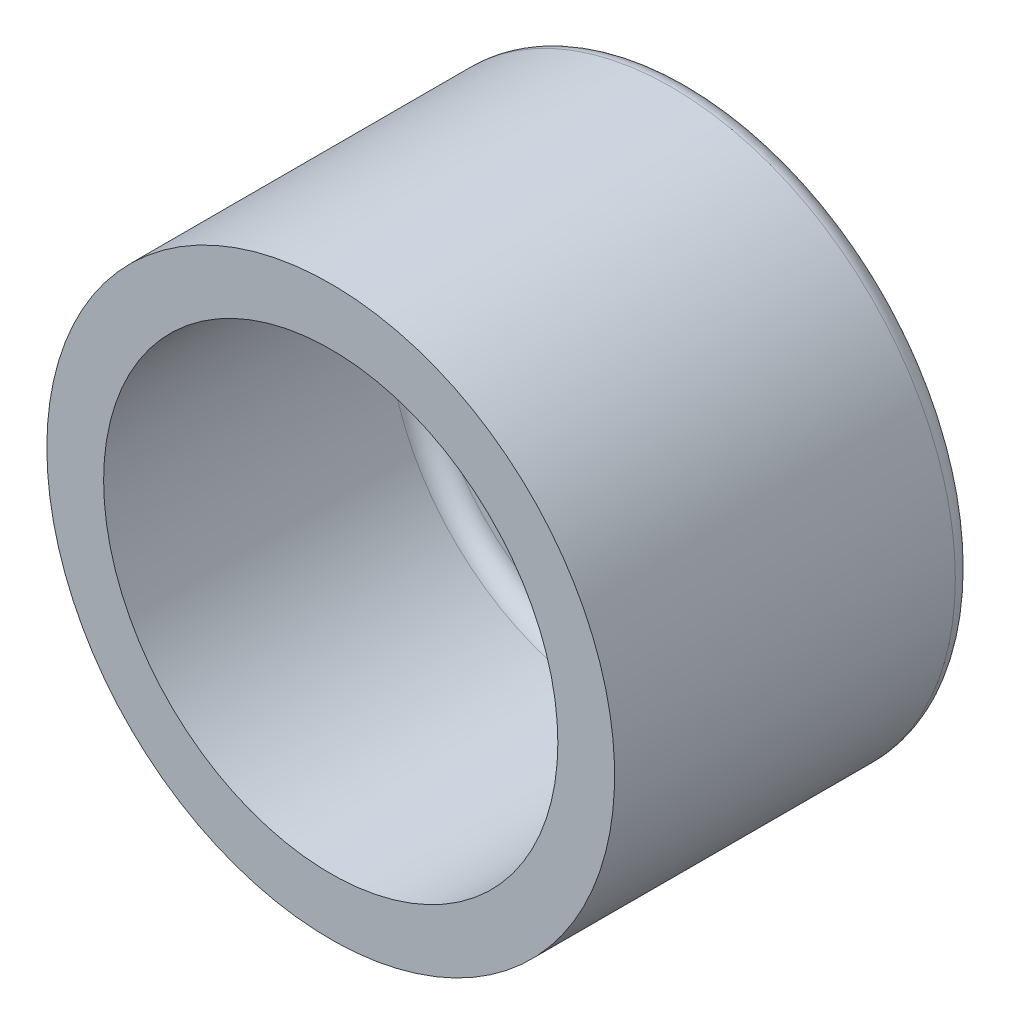
from build123d import *

# Parameters (mm, degrees)
FILLET1_R = 0.5


with BuildPart() as part:
    # Sketch1 → Revolve1 (revolve)
    with BuildSketch(Plane(origin=(0, 0, 0), x_dir=(1, 0, 0), z_dir=(0, 1, 0))):
        Polygon((0, 0), (6, 0), (6, -8), (7.5, -8), (7.5, 1.5), (0, 1.5), align=None)
    revolve(axis=Axis((0, 0, 0), (0, 0, 1)))

    # Fillet1
    fillet1_edges = [part.edges().sort_by_distance(p)[0] for p in [
        (-7.5, 0, -1.5),
        (-6, 0, 0),
    ]]
    fillet(fillet1_edges, radius=FILLET1_R)


solid = part.part
